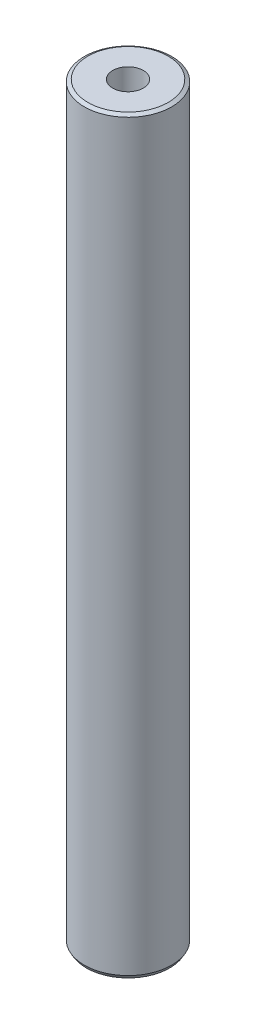
from build123d import *
from OCP.BRepFilletAPI import BRepFilletAPI_MakeChamfer

# Parameters (mm, degrees)
SKETCH1_R           = 35
BOSS_EXTRUDE1_DEPTH = 600
SKETCH2_R           = 12.273754956
CUT_EXTRUDE1_DEPTH  = 603.038204768
CHAMFER1_SIZE       = 1.628049017
CHAMFER1_SIZE2      = 2.819863615


with BuildPart() as part:
    # Sketch1 → Boss-Extrude1 (new body)
    with BuildSketch(Plane(origin=(0, 0, 0), x_dir=(1, 0, 0), z_dir=(0, 1, 0))):
        Circle(SKETCH1_R)
    extrude(amount=BOSS_EXTRUDE1_DEPTH)

    # Sketch2 → Cut-Extrude1 (cut, through all)
    with BuildSketch(Plane(origin=(0, 0, 0), x_dir=(1, 0, 0), z_dir=(0, 1, 0))):
        Circle(SKETCH2_R)
    extrude(amount=CUT_EXTRUDE1_DEPTH, mode=Mode.SUBTRACT)

    # Chamfer1: one chamfer whose edges measure the first distance from different faces: ONE call of the kernel's chamfer builder (chamfer() names one face for all edges)
    chamfer1_edges_1 = [part.edges().sort_by_distance(p)[0] for p in [
        (-35, 600, 0),
    ]]
    chamfer1_side_1 = [part.faces().sort_by_distance(p)[0] for p in [
        (-35, 300, 0),
    ]]
    chamfer1_edges_2 = [part.edges().sort_by_distance(p)[0] for p in [
        (-35, 0, 0),
    ]]
    chamfer1_side_2 = [part.faces().sort_by_distance(p)[0] for p in [
        (-34.010050506, 0, 0),
    ]]
    chamfer1 = BRepFilletAPI_MakeChamfer(part.part.solid().wrapped)
    for e in chamfer1_edges_1:
        chamfer1.Add(CHAMFER1_SIZE, CHAMFER1_SIZE2, e.wrapped, chamfer1_side_1[0].wrapped)  # the first distance lies on this face
    for e in chamfer1_edges_2:
        chamfer1.Add(CHAMFER1_SIZE, CHAMFER1_SIZE2, e.wrapped, chamfer1_side_2[0].wrapped)  # the first distance lies on this face
    add(Compound.cast(chamfer1.Shape()), mode=Mode.REPLACE)


solid = part.part
